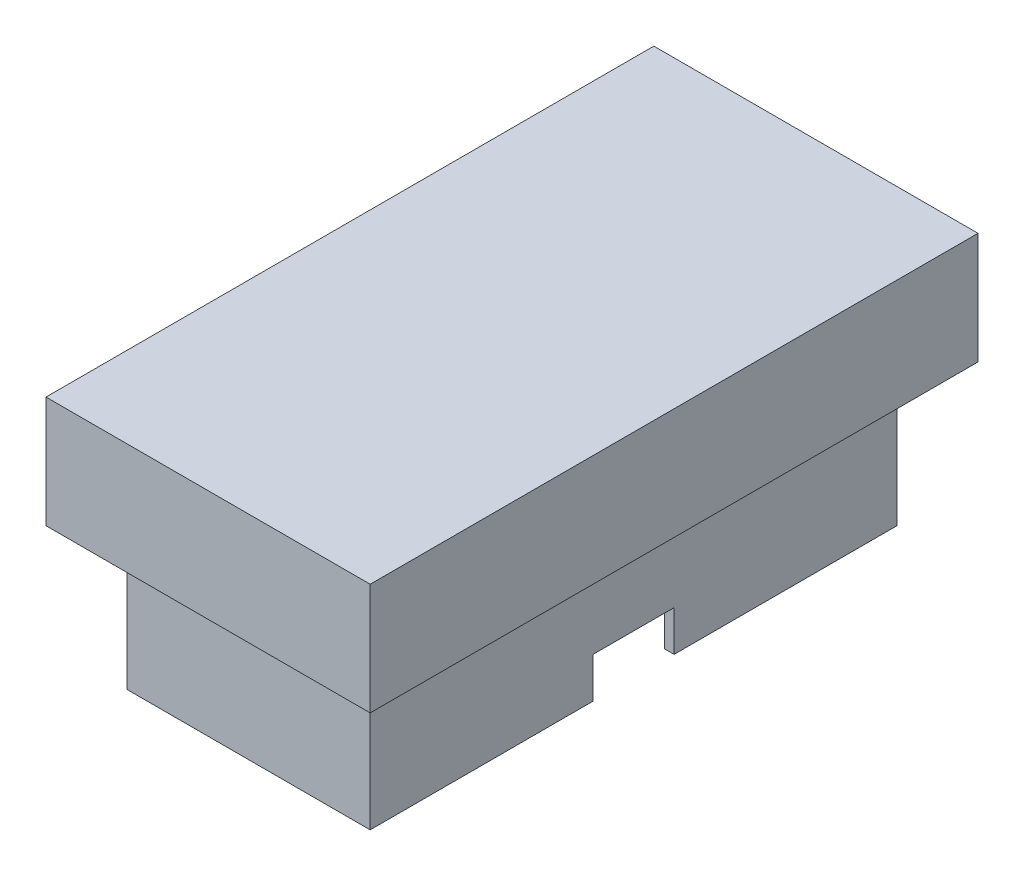
from build123d import *

# Parameters (mm, degrees)
SKETCH1_W               = 6
SKETCH1_H               = 13
SKETCH1_W_2             = 5.538461538
SKETCH1_H_2             = 12
BOSS_EXTRUDE1_DEPTH     = 3.5
CUT_EXTRUDE1_DEPTH      = 10.513148795
CUT_EXTRUDE1_DEPTH_BACK = 10.513148795
SKETCH3_W               = 2
SKETCH3_H               = 1
SKETCH4_W               = 8
SKETCH4_H               = 15
SKETCH4_W_2             = 7
SKETCH4_H_2             = 13.125
BOSS_EXTRUDE2_DEPTH     = 2.5
SKETCH5_W               = 7
SKETCH5_H               = 13.125
BOSS_EXTRUDE3_DEPTH     = 0.5
CUT_EXTRUDE2_DEPTH      = 10.013878189
CUT_EXTRUDE2_DEPTH_BACK = 10.013878189
SKETCH6_W               = 5.538461538
SKETCH6_H               = 12
SKETCH7_W               = 8
SKETCH7_H               = 15
BOSS_EXTRUDE4_DEPTH     = 0.25


with BuildPart() as part:
    # Sketch1 → Boss-Extrude1 (new body)
    with BuildSketch(Plane(origin=(0, 0, 0), x_dir=(1, 0, 0), z_dir=(0, 1, 0))):
        Rectangle(SKETCH1_W, SKETCH1_H)
        Rectangle(SKETCH1_W_2, SKETCH1_H_2, mode=Mode.SUBTRACT)
    extrude(amount=BOSS_EXTRUDE1_DEPTH)

    # Sketch3 → Cut-Extrude1 (cut, two sides: drawn at the far end of the back side and taken through both)
    with BuildSketch(Plane(origin=(3, 0, 0), x_dir=(0, 0, -1), z_dir=(1, 0, 0)).offset(-CUT_EXTRUDE1_DEPTH_BACK)):
        with Locations((0, 0.5)):
            Rectangle(SKETCH3_W, SKETCH3_H)
    extrude(amount=CUT_EXTRUDE1_DEPTH + CUT_EXTRUDE1_DEPTH_BACK, mode=Mode.SUBTRACT)

    # Sketch5 → Boss-Extrude3 (add)
    with BuildSketch(Plane.XZ.offset(-3.5)):
        Rectangle(SKETCH5_W, SKETCH5_H)
    extrude(amount=BOSS_EXTRUDE3_DEPTH)

    # Sketch6 → Cut-Extrude2 (cut, two sides: drawn at the far end of the back side and taken through both)
    with BuildSketch(Plane.XZ.offset(-3).offset(-CUT_EXTRUDE2_DEPTH_BACK)):
        Rectangle(SKETCH6_W, SKETCH6_H)
    extrude(amount=CUT_EXTRUDE2_DEPTH + CUT_EXTRUDE2_DEPTH_BACK, mode=Mode.SUBTRACT)


with BuildPart() as body_2:
    # Sketch4 → Boss-Extrude2 (new body)
    with BuildSketch(Plane(origin=(0, 3.5, 0), x_dir=(1, 0, 0), z_dir=(0, 1, 0))):
        Rectangle(SKETCH4_W, SKETCH4_H)
        Rectangle(SKETCH4_W_2, SKETCH4_H_2, mode=Mode.SUBTRACT)
    extrude(amount=BOSS_EXTRUDE2_DEPTH)

    # Sketch7 → Boss-Extrude4 (add)
    with BuildSketch(Plane(origin=(0, 6, 0), x_dir=(1, 0, 0), z_dir=(0, 1, 0))):
        Rectangle(SKETCH7_W, SKETCH7_H)
    extrude(amount=BOSS_EXTRUDE4_DEPTH)


solid = Compound([part.part, body_2.part])
